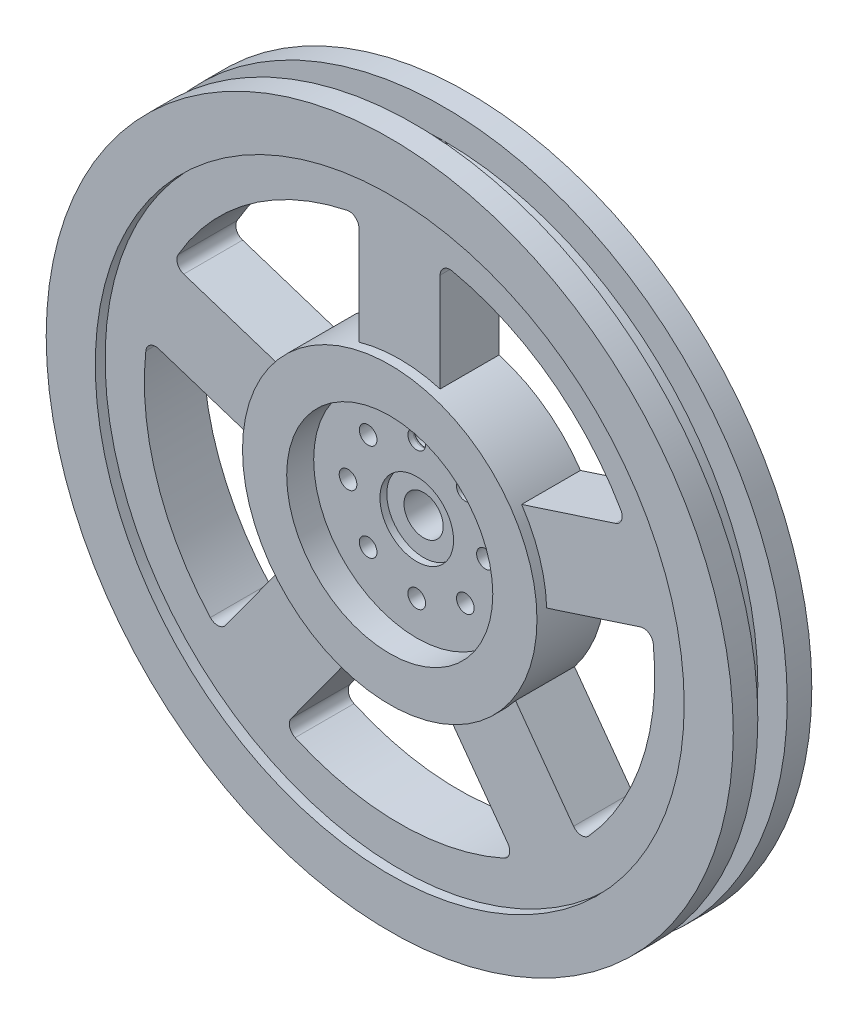
from build123d import *
from build123d.topology import SkipClean

# Parameters (mm, degrees)
SKETCH4_R              = 10.5
CUT_EXTRUDE2_DEPTH     = 2.75
SKETCH5_R              = 3.75
CUT_EXTRUDE3_DEPTH     = 0.7
SKETCH6_R              = 0.9
CUT_EXTRUDE4_DEPTH     = 50.775119287
SKETCH11_R             = 2
CUT_EXTRUDE8_DEPTH     = 50.70616159
CUT_EXTRUDE9_START     = -25
CUT_EXTRUDE9_OUTLINE_R = 1
CUT_EXTRUDE9_DEPTH     = 26
SKETCH18_R             = 30
CUT_EXTRUDE12_DEPTH    = 1
CUT_EXTRUDE13_START    = -1
SKETCH19_R             = 30
SKETCH19_R_2           = 15
CUT_EXTRUDE13_DEPTH    = 1
CUT_EXTRUDE14_DEPTH    = 50.989999
CIRPATTERN4_COUNT      = 5


with BuildPart() as part:
    # Sketch2 → Revolve1 (revolve)
    with BuildSketch(Plane(origin=(0, 0, 0), x_dir=(1, 0, 0), z_dir=(0, 1, 0))):
        Polygon((0, 0), (35, 0), (35, 2.5), (32, 2.5), (32, 5.5), (35, 5.5), (35, 8), (0, 8), align=None)
    revolve(axis=Axis((0, 0, 27.772111005), (0, 0, -1)))

    # Sketch4 → Cut-Extrude2 (cut)
    with BuildSketch(Plane.XY):
        Circle(SKETCH4_R)
    extrude(amount=-CUT_EXTRUDE2_DEPTH, mode=Mode.SUBTRACT)

    # Sketch5 → Cut-Extrude3 (cut)
    with BuildSketch(Plane.XY.offset(-2.75)):
        Circle(SKETCH5_R)
    extrude(amount=-CUT_EXTRUDE3_DEPTH, mode=Mode.SUBTRACT)

    # Sketch6 → Cut-Extrude4 (cut, through all)
    with BuildSketch(Plane.XY.offset(-2.75)):
        with Locations((0, 7)):
            Circle(SKETCH6_R)
        with Locations((4.949747468, 4.949747468)):
            Circle(SKETCH6_R)
        with Locations((7, 0)):
            Circle(SKETCH6_R)
        with Locations((4.949747468, -4.949747468)):
            Circle(SKETCH6_R)
        with Locations((0, -7)):
            Circle(SKETCH6_R)
        with Locations((-4.949747468, -4.949747468)):
            Circle(SKETCH6_R)
        with Locations((-7, 0)):
            Circle(SKETCH6_R)
        with Locations((-4.949747468, 4.949747468)):
            Circle(SKETCH6_R)
    extrude(amount=-CUT_EXTRUDE4_DEPTH, mode=Mode.SUBTRACT)

    # Sketch11 → Cut-Extrude8 (cut, through all)
    with BuildSketch(Plane.XY.offset(-3.45)):
        Circle(SKETCH11_R)
    extrude(amount=-CUT_EXTRUDE8_DEPTH, mode=Mode.SUBTRACT)

    # Cut-Extrude9: read off the stored shape, not the designer's step
    # Cut-Extrude9 outline → Cut-Extrude9 (cut)
    with BuildSketch(Plane(origin=(0, 32, 0), x_dir=(1, 0, 0), z_dir=(0, 1, 0)).offset(CUT_EXTRUDE9_START)):
        with Locations((0, 4.5)):
            Circle(CUT_EXTRUDE9_OUTLINE_R)
    extrude(amount=CUT_EXTRUDE9_DEPTH, mode=Mode.SUBTRACT)

    # Fillet4: read off the stored shape, not the designer's step
    # Fillet4 outline → Fillet4 (revolve, cut)
    with SkipClean():  # the faces are left unmerged after this step: merging them gives an invalid solid
        with BuildSketch(Plane.XZ.offset(-7)):
            with BuildLine():
                Line((1, -5.5), (1, -3.5))
                ThreePointArc((1, -3.5), (0.926138721, -3.398867689), (0.9, -3.276393202))
                Line((0.9, -3.276393202), (0.9, -5.723606798))
                ThreePointArc((0.9, -5.723606798), (0.926138721, -5.601132311), (1, -5.5))
            make_face()
        revolve(axis=Axis((0, 7, 0), (0, 0, 1)), mode=Mode.SUBTRACT)

    # Sketch18 → Cut-Extrude12 (cut)
    with SkipClean():  # the faces are left unmerged after this step: merging them gives an invalid solid
        with BuildSketch(Plane(origin=(0, 0, -8), x_dir=(-1, 0, 0), z_dir=(0, 0, -1))):
            Circle(SKETCH18_R)
        extrude(amount=-CUT_EXTRUDE12_DEPTH, mode=Mode.SUBTRACT)

    # Sketch19 → Cut-Extrude13 (cut)
    with SkipClean():  # the faces are left unmerged after this step: merging them gives an invalid solid
        with BuildSketch(Plane.XY.offset(CUT_EXTRUDE13_START)):
            with Locations(Location((0, 0, 0), (0, 0, 180))):
                Circle(SKETCH19_R)
            Circle(SKETCH19_R_2, mode=Mode.SUBTRACT)
        extrude(amount=CUT_EXTRUDE13_DEPTH, mode=Mode.SUBTRACT)

    # Sketch20 → Cut-Extrude14 (cut, symmetric)
    with SkipClean():  # the faces are left unmerged after this step: merging them gives an invalid solid
        with BuildSketch(Plane.XY.offset(-1)):
            with BuildLine():
                Line((12.435563588, 8.387893552), (21.991893156, 11.492933252))
                ThreePointArc((21.991893156, 11.492933252), (22.615992604, 12.084415431), (22.550191208, 12.941749359))
                ThreePointArc((22.550191208, 12.941749359), (15.28241656, 21.034441854), (5.339942751, 25.445726781))
                ThreePointArc((5.339942751, 25.445726781), (4.504235982, 25.243376874), (4.134560337, 24.467044982))
                Line((4.134560337, 24.467044982), (4.134560337, 14.418925439))
                ThreePointArc((4.134560337, 14.418925439), (8.816778784, 12.135254916), (12.435563588, 8.387893552))
            make_face()
        cut_extrude14 = extrude(amount=CUT_EXTRUDE14_DEPTH, both=True, mode=Mode.SUBTRACT)

    # CirPattern4: Cut-Extrude14 ×5 about axis
    with SkipClean():  # the faces are left unmerged after this step: merging them gives an invalid solid
        cirpattern4_axis = Axis((0, 0, 0), (0, 0, 1))
        for i in range(1, CIRPATTERN4_COUNT):
            add(cut_extrude14.rotate(cirpattern4_axis, i * 360 / CIRPATTERN4_COUNT), mode=Mode.SUBTRACT)


solid = part.part
